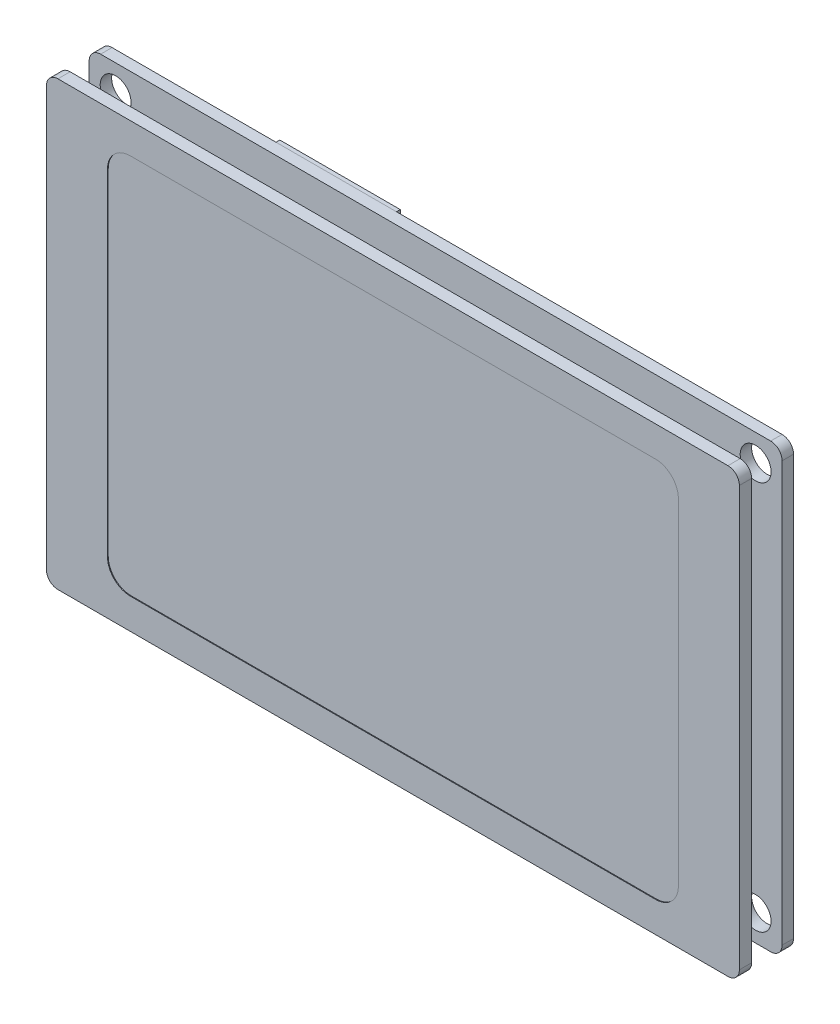
from build123d import *

# Parameters (mm, degrees)
SKETCH1_W             = 90.87
SKETCH1_H             = 58.01
SKETCH1_R             = 2.025
BOSS_EXTRUDE1_DEPTH   = 1.5
FILLET1_R             = 1.5
SKETCH2_W             = 4.5
SKETCH2_H             = 40.5
SKETCH2_W_2           = 1.5
SKETCH2_H_2           = 1.5
BOSS_EXTRUDE2_DEPTH   = 5
SKETCH2_W_3           = 40.5
SKETCH2_H_3           = 4.5
BOSS_EXTRUDE2_2_DEPTH = 5
SKETCH3_W             = 15.8
SKETCH3_H             = 31.3
BOSS_EXTRUDE3_DEPTH   = 0.5
BOSS_EXTRUDE4_DEPTH   = 2.7
SKETCH5_W             = 80
SKETCH5_H             = 45
BOSS_EXTRUDE5_DEPTH   = 4
BOSS_EXTRUDE6_DEPTH   = 1.6
CUT_EXTRUDE1_DEPTH    = 0.1


with BuildPart() as part:
    # Sketch1 → Boss-Extrude1 (new body)
    with BuildSketch(Plane.XY):
        Rectangle(SKETCH1_W, SKETCH1_H)
        with Locations((-41.965, 25.515)):
            Circle(SKETCH1_R, mode=Mode.SUBTRACT)
        with Locations((-41.965, -25.515)):
            Circle(SKETCH1_R, mode=Mode.SUBTRACT)
        with Locations((41.965, -25.515)):
            Circle(SKETCH1_R, mode=Mode.SUBTRACT)
        with Locations((41.965, 25.515)):
            Circle(SKETCH1_R, mode=Mode.SUBTRACT)
    extrude(amount=BOSS_EXTRUDE1_DEPTH)

    # Fillet1
    fillet1_edges = [part.edges().sort_by_distance(p)[0] for p in [
        (45.435, -29.005, 0.75),
        (-45.435, -29.005, 0.75),
        (-45.435, 29.005, 0.75),
        (45.435, 29.005, 0.75),
    ]]
    fillet(fillet1_edges, radius=FILLET1_R)


with BuildPart() as body_2:
    # Sketch2 → Boss-Extrude2 (new body)
    with BuildSketch(Plane(origin=(0, 0, 0), x_dir=(-1, 0, 0), z_dir=(0, 0, -1))):
        with Locations((40.185, 0.245)):
            Rectangle(SKETCH2_W, SKETCH2_H)
        with Locations((41.185, 19.245)):
            Rectangle(SKETCH2_W_2, SKETCH2_H_2, mode=Mode.SUBTRACT)
        with Locations((39.185, 19.245)):
            Rectangle(SKETCH2_W_2, SKETCH2_H_2, mode=Mode.SUBTRACT)
        with Locations((41.185, 17.245)):
            Rectangle(SKETCH2_W_2, SKETCH2_H_2, mode=Mode.SUBTRACT)
        with Locations((41.185, 15.245)):
            Rectangle(SKETCH2_W_2, SKETCH2_H_2, mode=Mode.SUBTRACT)
        with Locations((41.185, 13.245)):
            Rectangle(SKETCH2_W_2, SKETCH2_H_2, mode=Mode.SUBTRACT)
        with Locations((41.185, 11.245)):
            Rectangle(SKETCH2_W_2, SKETCH2_H_2, mode=Mode.SUBTRACT)
        with Locations((41.185, 9.245)):
            Rectangle(SKETCH2_W_2, SKETCH2_H_2, mode=Mode.SUBTRACT)
        with Locations((41.185, 7.245)):
            Rectangle(SKETCH2_W_2, SKETCH2_H_2, mode=Mode.SUBTRACT)
        with Locations((41.185, 5.245)):
            Rectangle(SKETCH2_W_2, SKETCH2_H_2, mode=Mode.SUBTRACT)
        with Locations((41.185, 3.245)):
            Rectangle(SKETCH2_W_2, SKETCH2_H_2, mode=Mode.SUBTRACT)
        with Locations((41.185, 1.245)):
            Rectangle(SKETCH2_W_2, SKETCH2_H_2, mode=Mode.SUBTRACT)
        with Locations((41.185, -0.755)):
            Rectangle(SKETCH2_W_2, SKETCH2_H_2, mode=Mode.SUBTRACT)
        with Locations((41.185, -2.755)):
            Rectangle(SKETCH2_W_2, SKETCH2_H_2, mode=Mode.SUBTRACT)
        with Locations((41.185, -4.755)):
            Rectangle(SKETCH2_W_2, SKETCH2_H_2, mode=Mode.SUBTRACT)
        with Locations((41.185, -6.755)):
            Rectangle(SKETCH2_W_2, SKETCH2_H_2, mode=Mode.SUBTRACT)
        with Locations((41.185, -8.755)):
            Rectangle(SKETCH2_W_2, SKETCH2_H_2, mode=Mode.SUBTRACT)
        with Locations((41.185, -10.755)):
            Rectangle(SKETCH2_W_2, SKETCH2_H_2, mode=Mode.SUBTRACT)
        with Locations((41.185, -12.755)):
            Rectangle(SKETCH2_W_2, SKETCH2_H_2, mode=Mode.SUBTRACT)
        with Locations((41.185, -14.755)):
            Rectangle(SKETCH2_W_2, SKETCH2_H_2, mode=Mode.SUBTRACT)
        with Locations((41.185, -16.755)):
            Rectangle(SKETCH2_W_2, SKETCH2_H_2, mode=Mode.SUBTRACT)
        with Locations((41.185, -18.755)):
            Rectangle(SKETCH2_W_2, SKETCH2_H_2, mode=Mode.SUBTRACT)
        with Locations((39.185, 17.245)):
            Rectangle(SKETCH2_W_2, SKETCH2_H_2, mode=Mode.SUBTRACT)
        with Locations((39.185, 15.245)):
            Rectangle(SKETCH2_W_2, SKETCH2_H_2, mode=Mode.SUBTRACT)
        with Locations((39.185, 13.245)):
            Rectangle(SKETCH2_W_2, SKETCH2_H_2, mode=Mode.SUBTRACT)
        with Locations((39.185, 11.245)):
            Rectangle(SKETCH2_W_2, SKETCH2_H_2, mode=Mode.SUBTRACT)
        with Locations((39.185, 9.245)):
            Rectangle(SKETCH2_W_2, SKETCH2_H_2, mode=Mode.SUBTRACT)
        with Locations((39.185, 7.245)):
            Rectangle(SKETCH2_W_2, SKETCH2_H_2, mode=Mode.SUBTRACT)
        with Locations((39.185, 5.245)):
            Rectangle(SKETCH2_W_2, SKETCH2_H_2, mode=Mode.SUBTRACT)
        with Locations((39.185, 3.245)):
            Rectangle(SKETCH2_W_2, SKETCH2_H_2, mode=Mode.SUBTRACT)
        with Locations((39.185, 1.245)):
            Rectangle(SKETCH2_W_2, SKETCH2_H_2, mode=Mode.SUBTRACT)
        with Locations((39.185, -0.755)):
            Rectangle(SKETCH2_W_2, SKETCH2_H_2, mode=Mode.SUBTRACT)
        with Locations((39.185, -2.755)):
            Rectangle(SKETCH2_W_2, SKETCH2_H_2, mode=Mode.SUBTRACT)
        with Locations((39.185, -4.755)):
            Rectangle(SKETCH2_W_2, SKETCH2_H_2, mode=Mode.SUBTRACT)
        with Locations((39.185, -6.755)):
            Rectangle(SKETCH2_W_2, SKETCH2_H_2, mode=Mode.SUBTRACT)
        with Locations((39.185, -8.755)):
            Rectangle(SKETCH2_W_2, SKETCH2_H_2, mode=Mode.SUBTRACT)
        with Locations((39.185, -10.755)):
            Rectangle(SKETCH2_W_2, SKETCH2_H_2, mode=Mode.SUBTRACT)
        with Locations((39.185, -12.755)):
            Rectangle(SKETCH2_W_2, SKETCH2_H_2, mode=Mode.SUBTRACT)
        with Locations((39.185, -14.755)):
            Rectangle(SKETCH2_W_2, SKETCH2_H_2, mode=Mode.SUBTRACT)
        with Locations((39.185, -16.755)):
            Rectangle(SKETCH2_W_2, SKETCH2_H_2, mode=Mode.SUBTRACT)
        with Locations((39.185, -18.755)):
            Rectangle(SKETCH2_W_2, SKETCH2_H_2, mode=Mode.SUBTRACT)
    extrude(amount=BOSS_EXTRUDE2_DEPTH)


with BuildPart() as body_3:
    # Sketch2 → Boss-Extrude2 2 (new body)
    with BuildSketch(Plane(origin=(0, 0, 0), x_dir=(-1, 0, 0), z_dir=(0, 0, -1))):
        with Locations((0.185, -23.755)):
            Rectangle(SKETCH2_W_3, SKETCH2_H_3)
        with Locations((-16.815, -22.755)):
            Rectangle(SKETCH2_W_2, SKETCH2_H_2, mode=Mode.SUBTRACT)
        with Locations((-18.815, -22.755)):
            Rectangle(SKETCH2_W_2, SKETCH2_H_2, mode=Mode.SUBTRACT)
        with Locations((-14.815, -22.755)):
            Rectangle(SKETCH2_W_2, SKETCH2_H_2, mode=Mode.SUBTRACT)
        with Locations((-12.815, -22.755)):
            Rectangle(SKETCH2_W_2, SKETCH2_H_2, mode=Mode.SUBTRACT)
        with Locations((-10.815, -22.755)):
            Rectangle(SKETCH2_W_2, SKETCH2_H_2, mode=Mode.SUBTRACT)
        with Locations((-8.815, -22.755)):
            Rectangle(SKETCH2_W_2, SKETCH2_H_2, mode=Mode.SUBTRACT)
        with Locations((-6.815, -22.755)):
            Rectangle(SKETCH2_W_2, SKETCH2_H_2, mode=Mode.SUBTRACT)
        with Locations((-4.815, -22.755)):
            Rectangle(SKETCH2_W_2, SKETCH2_H_2, mode=Mode.SUBTRACT)
        with Locations((-2.815, -22.755)):
            Rectangle(SKETCH2_W_2, SKETCH2_H_2, mode=Mode.SUBTRACT)
        with Locations((-0.815, -22.755)):
            Rectangle(SKETCH2_W_2, SKETCH2_H_2, mode=Mode.SUBTRACT)
        with Locations((1.185, -22.755)):
            Rectangle(SKETCH2_W_2, SKETCH2_H_2, mode=Mode.SUBTRACT)
        with Locations((3.185, -22.755)):
            Rectangle(SKETCH2_W_2, SKETCH2_H_2, mode=Mode.SUBTRACT)
        with Locations((5.185, -22.755)):
            Rectangle(SKETCH2_W_2, SKETCH2_H_2, mode=Mode.SUBTRACT)
        with Locations((7.185, -22.755)):
            Rectangle(SKETCH2_W_2, SKETCH2_H_2, mode=Mode.SUBTRACT)
        with Locations((9.185, -22.755)):
            Rectangle(SKETCH2_W_2, SKETCH2_H_2, mode=Mode.SUBTRACT)
        with Locations((11.185, -22.755)):
            Rectangle(SKETCH2_W_2, SKETCH2_H_2, mode=Mode.SUBTRACT)
        with Locations((13.185, -22.755)):
            Rectangle(SKETCH2_W_2, SKETCH2_H_2, mode=Mode.SUBTRACT)
        with Locations((15.185, -22.755)):
            Rectangle(SKETCH2_W_2, SKETCH2_H_2, mode=Mode.SUBTRACT)
        with Locations((17.185, -22.755)):
            Rectangle(SKETCH2_W_2, SKETCH2_H_2, mode=Mode.SUBTRACT)
        with Locations((19.185, -22.755)):
            Rectangle(SKETCH2_W_2, SKETCH2_H_2, mode=Mode.SUBTRACT)
        with Locations((-16.815, -24.755)):
            Rectangle(SKETCH2_W_2, SKETCH2_H_2, mode=Mode.SUBTRACT)
        with Locations((-14.815, -24.755)):
            Rectangle(SKETCH2_W_2, SKETCH2_H_2, mode=Mode.SUBTRACT)
        with Locations((-12.815, -24.755)):
            Rectangle(SKETCH2_W_2, SKETCH2_H_2, mode=Mode.SUBTRACT)
        with Locations((-10.815, -24.755)):
            Rectangle(SKETCH2_W_2, SKETCH2_H_2, mode=Mode.SUBTRACT)
        with Locations((-8.815, -24.755)):
            Rectangle(SKETCH2_W_2, SKETCH2_H_2, mode=Mode.SUBTRACT)
        with Locations((-6.815, -24.755)):
            Rectangle(SKETCH2_W_2, SKETCH2_H_2, mode=Mode.SUBTRACT)
        with Locations((-4.815, -24.755)):
            Rectangle(SKETCH2_W_2, SKETCH2_H_2, mode=Mode.SUBTRACT)
        with Locations((-2.815, -24.755)):
            Rectangle(SKETCH2_W_2, SKETCH2_H_2, mode=Mode.SUBTRACT)
        with Locations((-0.815, -24.755)):
            Rectangle(SKETCH2_W_2, SKETCH2_H_2, mode=Mode.SUBTRACT)
        with Locations((1.185, -24.755)):
            Rectangle(SKETCH2_W_2, SKETCH2_H_2, mode=Mode.SUBTRACT)
        with Locations((3.185, -24.755)):
            Rectangle(SKETCH2_W_2, SKETCH2_H_2, mode=Mode.SUBTRACT)
        with Locations((5.185, -24.755)):
            Rectangle(SKETCH2_W_2, SKETCH2_H_2, mode=Mode.SUBTRACT)
        with Locations((7.185, -24.755)):
            Rectangle(SKETCH2_W_2, SKETCH2_H_2, mode=Mode.SUBTRACT)
        with Locations((9.185, -24.755)):
            Rectangle(SKETCH2_W_2, SKETCH2_H_2, mode=Mode.SUBTRACT)
        with Locations((11.185, -24.755)):
            Rectangle(SKETCH2_W_2, SKETCH2_H_2, mode=Mode.SUBTRACT)
        with Locations((13.185, -24.755)):
            Rectangle(SKETCH2_W_2, SKETCH2_H_2, mode=Mode.SUBTRACT)
        with Locations((15.185, -24.755)):
            Rectangle(SKETCH2_W_2, SKETCH2_H_2, mode=Mode.SUBTRACT)
        with Locations((17.185, -24.755)):
            Rectangle(SKETCH2_W_2, SKETCH2_H_2, mode=Mode.SUBTRACT)
        with Locations((19.185, -24.755)):
            Rectangle(SKETCH2_W_2, SKETCH2_H_2, mode=Mode.SUBTRACT)
        with Locations((-18.815, -24.755)):
            Rectangle(SKETCH2_W_2, SKETCH2_H_2, mode=Mode.SUBTRACT)
    extrude(amount=BOSS_EXTRUDE2_2_DEPTH)


with BuildPart() as body_4:
    # Sketch3 → Boss-Extrude3 (new body)
    with BuildSketch(Plane(origin=(0, 0, 0), x_dir=(-1, 0, 0), z_dir=(0, 0, -1))):
        with Locations((14.535, 13.355)):
            Rectangle(SKETCH3_W, SKETCH3_H)
    extrude(amount=BOSS_EXTRUDE3_DEPTH)


with BuildPart() as body_5:
    # Sketch4 → Boss-Extrude4 (new body)
    with BuildSketch(Plane(origin=(0, 0, -0.5), x_dir=(-1, 0, 0), z_dir=(0, 0, -1))):
        Polygon((6.635, -2.295), (22.435, -2.295), (22.435, 17.705), (15.935, 17.705), (15.935, 21.705), (6.635, 21.705), align=None)
    extrude(amount=BOSS_EXTRUDE4_DEPTH)


with BuildPart() as body_6:
    # Sketch5 → Boss-Extrude5 (new body)
    with BuildSketch(Plane.XY.offset(1.5)):
        Rectangle(SKETCH5_W, SKETCH5_H)
    extrude(amount=BOSS_EXTRUDE5_DEPTH)


with BuildPart() as body_7:
    # Sketch6 → Boss-Extrude6 (new body)
    with BuildSketch(Plane.XY.offset(5.5)):
        with BuildLine():
            Line((-43.935, -29.005), (43.935, -29.005))
            ThreePointArc((43.935, -29.005), (44.995660172, -28.565660172), (45.435, -27.505))
            Line((45.435, -27.505), (45.435, 27.505))
            ThreePointArc((45.435, 27.505), (44.995660172, 28.565660172), (43.935, 29.005))
            Line((43.935, 29.005), (-43.935, 29.005))
            ThreePointArc((-43.935, 29.005), (-44.995660172, 28.565660172), (-45.435, 27.505))
            Line((-45.435, 27.505), (-45.435, -27.505))
            ThreePointArc((-45.435, -27.505), (-44.995660172, -28.565660172), (-43.935, -29.005))
        make_face()
    extrude(amount=BOSS_EXTRUDE6_DEPTH)

    # Sketch7 → Cut-Extrude1 (cut)
    with BuildSketch(Plane.XY.offset(7.1)):
        with BuildLine():
            Line((-34.435, 25.005), (34.435, 25.005))
            ThreePointArc((34.435, 25.005), (36.556320344, 24.126320344), (37.435, 22.005))
            Line((37.435, 22.005), (37.435, -22.005))
            ThreePointArc((37.435, -22.005), (36.556320344, -24.126320344), (34.435, -25.005))
            Line((34.435, -25.005), (-34.435, -25.005))
            ThreePointArc((-34.435, -25.005), (-36.556320344, -24.126320344), (-37.435, -22.005))
            Line((-37.435, -22.005), (-37.435, 22.005))
            ThreePointArc((-37.435, 22.005), (-36.556320344, 24.126320344), (-34.435, 25.005))
        make_face()
    extrude(amount=-CUT_EXTRUDE1_DEPTH, mode=Mode.SUBTRACT)


solid = Compound([part.part, body_2.part, body_3.part, body_4.part, body_5.part, body_6.part, body_7.part])
